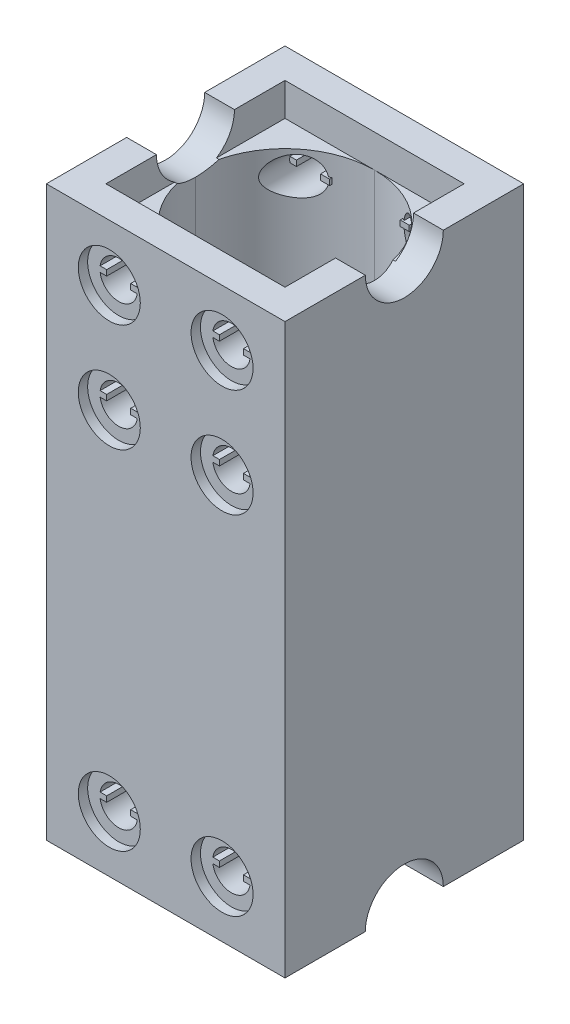
from build123d import *
from build123d.topology import SkipClean

# Parameters (mm, degrees)
SKETCH1_W           = 25.4
SKETCH1_H           = 25.4
SKETCH1_W_2         = 19.05
SKETCH1_H_2         = 19.05
BOSS_EXTRUDE1_DEPTH = 30.25
SKETCH2_R           = 2
CUT_EXTRUDE1_DEPTH  = 42.491113506
CUT_EXTRUDE2_DEPTH  = 42.491113506
CUT_EXTRUDE7_REACH  = 43.491
SKETCH9_R           = 2
FILLET1_START       = -9.525
FILLET1_OUTLINE_W   = 19.05
FILLET1_OUTLINE_H   = 60.5
FILLET1_OUTLINE_R   = 2
FILLET1_DEPTH       = 9.5000001
FILLET1_START_2     = 0.0249999
FILLET1_2_OUTLINE_W = 19.05
FILLET1_2_OUTLINE_H = 60.5
FILLET1_2_OUTLINE_R = 2
FILLET1_2_DEPTH     = 9.5000001
FILLET1_3_OUTLINE_R = 2
FILLET1_3_DEPTH     = 3.544211343
FILLET1_START_3     = -7.567803
FILLET1_4_OUTLINE_R = 2
FILLET1_4_DEPTH     = 2.380495584
FILLET1_5_DEPTH     = 19.05
FILLET1_START_4     = -0.025
FILLET1_6_DEPTH     = 0.0499999
FILLET1_START_5     = -30.25
FILLET1_7_DEPTH     = 60.5
FILLET1_START_6     = 10.7499999
FILLET1_8_DEPTH     = 4.0000001
SKETCH7_W           = 19.06
SKETCH7_H           = 19.06
CUT_EXTRUDE4_DEPTH  = 3.5
SKETCH4_R           = 1.175
CUT_EXTRUDE5_DEPTH  = 2.4
CUT_EXTRUDE8_DEPTH  = 2.4
BOSS_EXTRUDE3_DEPTH = 3.4
BOSS_EXTRUDE4_DEPTH = 3.4
SKETCH16_R          = 3.3
CUT_EXTRUDE9_DEPTH  = 1
SKETCH17_R          = 3.3
CUT_EXTRUDE10_DEPTH = 1


with BuildPart() as part:
    # Sketch1 → Boss-Extrude1 (new, symmetric)
    with BuildSketch(Plane(origin=(0, 0, 0), x_dir=(1, 0, 0), z_dir=(0, 1, 0))):
        Rectangle(SKETCH1_W, SKETCH1_H)
        Rectangle(SKETCH1_W_2, SKETCH1_H_2, mode=Mode.SUBTRACT)
    extrude(amount=BOSS_EXTRUDE1_DEPTH, both=True)

    # Sketch2 → Cut-Extrude1 (cut, through all)
    with BuildSketch(Plane(origin=(0, 0, 12.7), x_dir=(-1, 0, 0), z_dir=(0, 0, -1))):
        with Locations((-6, 24.25)):
            Circle(SKETCH2_R)
        with Locations((6, 24.25)):
            Circle(SKETCH2_R)
    cut_extrude1 = extrude(amount=CUT_EXTRUDE1_DEPTH, mode=Mode.SUBTRACT)

    # Sketch3 → Cut-Extrude2 (cut, through all)
    with BuildSketch(Plane(origin=(12.7, 0, 0), x_dir=(0, 0, -1), z_dir=(1, 0, 0))):
        with BuildLine():
            Line((-4.15, -30.25), (4.15, -30.25))
            ThreePointArc((4.15, -30.25), (0, -26.1), (-4.15, -30.25))
        make_face()
    cut_extrude2 = extrude(amount=-CUT_EXTRUDE2_DEPTH, mode=Mode.SUBTRACT)

    # Mirror2: Cut-Extrude1, Cut-Extrude2 across plane
    add(cut_extrude1.mirror(Plane.ZX), mode=Mode.SUBTRACT)
    add(cut_extrude2.mirror(Plane.ZX), mode=Mode.SUBTRACT)

    # Sketch9 → Cut-Extrude7 (cut, up to next)
    with BuildSketch(Plane.XY.offset(12.7), mode=Mode.PRIVATE) as cut_extrude7_sk1:
        with Locations((-6, 12.75)):
            Circle(SKETCH9_R)
    cut_extrude7_tool1 = extrude(cut_extrude7_sk1.sketch, amount=-CUT_EXTRUDE7_REACH, mode=Mode.PRIVATE) & part.part
    # Sketch9 → Cut-Extrude7 (cut, up to next)
    with BuildSketch(Plane.XY.offset(12.7), mode=Mode.PRIVATE) as cut_extrude7_sk2:
        with Locations((6, 12.75)):
            Circle(SKETCH9_R)
    cut_extrude7_tool2 = extrude(cut_extrude7_sk2.sketch, amount=-CUT_EXTRUDE7_REACH, mode=Mode.PRIVATE) & part.part
    add(cut_extrude7_tool1.solids().sort_by_distance((-6, 12.75, 12.7))[0], mode=Mode.SUBTRACT)
    add(cut_extrude7_tool2.solids().sort_by_distance((6, 12.75, 12.7))[0], mode=Mode.SUBTRACT)

    # Fillet1: read off the stored shape, not the designer's step
    # Fillet1 outline → Fillet1 (add)
    with SkipClean():  # the faces are left unmerged after this step: merging them gives an invalid solid
        with BuildSketch(Plane.XY.offset(FILLET1_START)):
            Rectangle(FILLET1_OUTLINE_W, FILLET1_OUTLINE_H)
            with Locations((-6, -24.25)):
                Circle(FILLET1_OUTLINE_R, mode=Mode.SUBTRACT)
            with Locations((6, -24.25)):
                Circle(FILLET1_OUTLINE_R, mode=Mode.SUBTRACT)
            with Locations((-6, 12.75)):
                Circle(FILLET1_OUTLINE_R, mode=Mode.SUBTRACT)
            with Locations((-6, 24.25)):
                Circle(FILLET1_OUTLINE_R, mode=Mode.SUBTRACT)
            with Locations((6, 12.75)):
                Circle(FILLET1_OUTLINE_R, mode=Mode.SUBTRACT)
            with Locations((6, 24.25)):
                Circle(FILLET1_OUTLINE_R, mode=Mode.SUBTRACT)
        extrude(amount=FILLET1_DEPTH)
    add(part.part.scale(1), mode=Mode.REPLACE)  # the faces are merged on a copy

    # Fillet1 2 outline → Fillet1 2 (add)
    with SkipClean():  # the faces are left unmerged after this step: merging them gives an invalid solid
        with BuildSketch(Plane.XY.offset(FILLET1_START_2)):
            Rectangle(FILLET1_2_OUTLINE_W, FILLET1_2_OUTLINE_H)
            with Locations((-6, -24.25)):
                Circle(FILLET1_2_OUTLINE_R, mode=Mode.SUBTRACT)
            with Locations((6, -24.25)):
                Circle(FILLET1_2_OUTLINE_R, mode=Mode.SUBTRACT)
            with Locations((-6, 12.75)):
                Circle(FILLET1_2_OUTLINE_R, mode=Mode.SUBTRACT)
            with Locations((-6, 24.25)):
                Circle(FILLET1_2_OUTLINE_R, mode=Mode.SUBTRACT)
            with Locations((6, 12.75)):
                Circle(FILLET1_2_OUTLINE_R, mode=Mode.SUBTRACT)
            with Locations((6, 24.25)):
                Circle(FILLET1_2_OUTLINE_R, mode=Mode.SUBTRACT)
        extrude(amount=FILLET1_2_DEPTH)

    # Fillet1 3 outline → Fillet1 3 (add)
    with BuildSketch(Plane.XY.offset(FILLET1_START)):
        with Locations((-6, 12.75)):
            Circle(FILLET1_3_OUTLINE_R)
        with Locations((6, 12.75)):
            Circle(FILLET1_3_OUTLINE_R)
    extrude(amount=FILLET1_3_DEPTH)

    # Fillet1 4 outline → Fillet1 4 (add)
    with BuildSketch(Plane.XY.offset(FILLET1_START_3)):
        with Locations((-6, 12.75)):
            Circle(FILLET1_4_OUTLINE_R)
    extrude(amount=FILLET1_4_DEPTH)

    # Fillet1 5 outline → Fillet1 5 (cut)
    with BuildSketch(Plane.YZ.offset(FILLET1_START)):
        with BuildLine():
            ThreePointArc((26.100075301, -0.0249999), (27.324359009, -2.94331867), (30.25, -4.15))
            Line((30.25, -4.15), (30.25, -0.0249999))
            Line((30.25, -0.0249999), (26.100075301, -0.0249999))
        make_face()
        with BuildLine():
            Line((-30.25, -0.0249999), (-30.25, -4.15))
            ThreePointArc((-30.25, -4.15), (-27.324359009, -2.94331867), (-26.100075301, -0.0249999))
            Line((-26.100075301, -0.0249999), (-30.25, -0.0249999))
        make_face()
        with BuildLine():
            ThreePointArc((30.25, 4.15), (27.324359009, 2.94331867), (26.100075301, 0.0249999))
            Line((26.100075301, 0.0249999), (30.25, 0.0249999))
            Line((30.25, 0.0249999), (30.25, 4.15))
        make_face()
        with BuildLine():
            Line((-30.25, 0.0249999), (-26.100075301, 0.0249999))
            ThreePointArc((-26.100075301, 0.0249999), (-27.324359009, 2.94331867), (-30.25, 4.15))
            Line((-30.25, 4.15), (-30.25, 0.0249999))
        make_face()
    extrude(amount=FILLET1_5_DEPTH, mode=Mode.SUBTRACT)

    # Fillet1 6 outline → Fillet1 6 (cut)
    with BuildSketch(Plane.YZ.offset(FILLET1_START_4)):
        with BuildLine():
            Line((-30.25, -9.525), (30.25, -9.525))
            Line((30.25, -9.525), (30.25, -4.15))
            ThreePointArc((30.25, -4.15), (27.324359009, -2.94331867), (26.100075301, -0.0249999))
            Line((26.100075301, -0.0249999), (-26.100075301, -0.0249999))
            ThreePointArc((-26.100075301, -0.0249999), (-27.324359009, -2.94331867), (-30.25, -4.15))
            Line((-30.25, -4.15), (-30.25, -9.525))
        make_face()
        with BuildLine():
            Line((-26.100075301, 0.0249999), (26.100075301, 0.0249999))
            ThreePointArc((26.100075301, 0.0249999), (27.324359009, 2.94331867), (30.25, 4.15))
            Line((30.25, 4.15), (30.25, 9.525))
            Line((30.25, 9.525), (-30.25, 9.525))
            Line((-30.25, 9.525), (-30.25, 4.15))
            ThreePointArc((-30.25, 4.15), (-27.324359009, 2.94331867), (-26.100075301, 0.0249999))
        make_face()
    extrude(amount=FILLET1_6_DEPTH, mode=Mode.SUBTRACT)

    # Fillet1 7 outline → Fillet1 7 (cut)
    with BuildSketch(Plane(origin=(0, 0, 0), x_dir=(1, 0, 0), z_dir=(0, 1, 0)).offset(FILLET1_START_5)):
        with BuildLine():
            Line((-0.025, 0.0249999), (-0.025, 9.525))
            ThreePointArc((-0.025, 9.525), (-6.742514439, 6.742514403), (-9.525, 0.02499995))
            Line((-9.525, 0.02499995), (-0.025, 0.0249999))
        make_face()
        with BuildLine():
            Line((0.02499995, 9.525), (0.0249999, 0.0249999))
            Line((0.0249999, 0.0249999), (9.525, 0.02499995))
            ThreePointArc((9.525, 0.02499995), (6.742514421, 6.742514421), (0.02499995, 9.525))
        make_face()
        with BuildLine():
            Line((-0.025, -0.0249999), (-9.525, -0.025))
            ThreePointArc((-9.525, -0.025), (-6.742514421, -6.742514421), (-0.025, -9.525))
            Line((-0.025, -9.525), (-0.025, -0.0249999))
        make_face()
        with BuildLine():
            Line((0.0249999, -0.0249999), (0.025, -9.525))
            ThreePointArc((0.025, -9.525), (6.742514421, -6.742514421), (9.525, -0.025))
            Line((9.525, -0.025), (0.0249999, -0.0249999))
        make_face()
    extrude(amount=FILLET1_7_DEPTH, mode=Mode.SUBTRACT)

    # Fillet1 8 outline → Fillet1 8 (add)
    with SkipClean():  # the faces are left unmerged after this step: merging them gives an invalid solid
        with BuildSketch(Plane(origin=(0, 0, 0), x_dir=(1, 0, 0), z_dir=(0, 1, 0)).offset(FILLET1_START_6)):
            with BuildLine():
                ThreePointArc((7.426255398, 5.980788657), (7.723356316, 5.591445007), (7.999997313, 5.187307416))
                Line((7.999997313, 5.187307416), (11, 5.187307416))
                Line((11, 5.187307416), (11, 5.980788657))
                Line((11, 5.980788657), (7.426255398, 5.980788657))
            make_face()
        extrude(amount=FILLET1_8_DEPTH)

    # Sketch7 → Cut-Extrude4 (cut)
    with SkipClean():  # the faces are left unmerged after this step: merging them gives an invalid solid
        with BuildSketch(Plane(origin=(0, 30.25, 0), x_dir=(1, 0, 0), z_dir=(0, 1, 0))):
            Rectangle(SKETCH7_W, SKETCH7_H)
        extrude(amount=-CUT_EXTRUDE4_DEPTH, mode=Mode.SUBTRACT)

    # Sketch4 → Cut-Extrude5 (cut)
    with SkipClean():  # the faces are left unmerged after this step: merging them gives an invalid solid
        with BuildSketch(Plane(origin=(0, -30.25, 0), x_dir=(1, 0, 0), z_dir=(0, 1, 0))):
            with Locations(Location((7.78, -7.78, 0), (0, 0, 270))):
                Circle(SKETCH4_R)
            with Locations(Location((-7.78, -7.78, 0), (0, 0, 270))):
                Circle(SKETCH4_R)
            with Locations(Location((7.78, 7.78, 0), (0, 0, 270))):
                Circle(SKETCH4_R)
            with Locations(Location((-7.78, 7.78, 0), (0, 0, 270))):
                Circle(SKETCH4_R)
        extrude(amount=CUT_EXTRUDE5_DEPTH, mode=Mode.SUBTRACT)

    # Sketch11 → Cut-Extrude8 (cut)
    with SkipClean():  # the faces are left unmerged after this step: merging them gives an invalid solid
        with BuildSketch(Plane.XZ.offset(30.25)):
            Polygon((-5.18, 6.2788893), (-5.18, 9.2811107), (-7.78, 10.7822214), (-10.38, 9.2811107), (-10.38, 6.2788893), (-7.78, 4.7777786), align=None)
            Polygon((10.38, 6.2788893), (7.78, 4.7777786), (5.18, 6.2788893), (5.18, 9.2811107), (7.78, 10.7822214), (10.38, 9.2811107), align=None)
            Polygon((5.18, -9.2811107), (7.78, -10.7822214), (10.38, -9.2811107), (10.38, -6.2788893), (7.78, -4.7777786), (5.18, -6.2788893), align=None)
            Polygon((-10.38, -6.2788893), (-7.78, -4.7777786), (-5.18, -6.2788893), (-5.18, -9.2811107), (-7.78, -10.7822214), (-10.38, -9.2811107), align=None)
        extrude(amount=-CUT_EXTRUDE8_DEPTH, mode=Mode.SUBTRACT)

    # Sketch13 → Boss-Extrude3 (add)
    with SkipClean():  # the faces are left unmerged after this step: merging them gives an invalid solid
        with BuildSketch(Plane.XY.offset(11.9)):
            Polygon((-7.977371993, 24.55), (-8.244428185, 24.55), (-8.244428185, 23.95), (-7.977371993, 23.95), (-7.277371993, 23.95), (-7.277371993, 24.55), align=None)
            Polygon((-4.022628007, 24.55), (-3.755571815, 24.55), (-3.755571815, 23.95), (-4.022628007, 23.95), (-4.722628007, 23.95), (-4.722628007, 24.55), align=None)
            Polygon((7.277371993, 24.55), (7.277371993, 23.95), (7.977371993, 23.95), (8.244428185, 23.95), (8.244428185, 24.55), (7.977371993, 24.55), align=None)
            Polygon((3.755571815, 24.55), (3.755571815, 23.95), (4.022628007, 23.95), (4.722628007, 23.95), (4.722628007, 24.55), (4.022628007, 24.55), align=None)
            Polygon((3.755571815, -23.95), (4.022628007, -23.95), (4.722628007, -23.95), (4.722628007, -24.55), (4.022628007, -24.55), (3.755571815, -24.55), align=None)
            Polygon((7.977371993, -23.95), (7.277371993, -23.95), (7.277371993, -24.55), (7.977371993, -24.55), (8.244428185, -24.55), (8.244428185, -23.95), align=None)
            Polygon((-4.022628007, -23.95), (-4.722628007, -23.95), (-4.722628007, -24.55), (-4.022628007, -24.55), (-3.755571815, -24.55), (-3.755571815, -23.95), align=None)
            Polygon((-8.244428185, -23.95), (-7.977371993, -23.95), (-7.277371993, -23.95), (-7.277371993, -24.55), (-7.977371993, -24.55), (-8.244428185, -24.55), align=None)
        boss_extrude3 = extrude(amount=-BOSS_EXTRUDE3_DEPTH)

    # Mirror3: Boss-Extrude3 across plane
    with SkipClean():  # the faces are left unmerged after this step: merging them gives an invalid solid
        add(boss_extrude3.mirror(Plane.XY))

    # Sketch14 → Boss-Extrude4 (add)
    with SkipClean():  # the faces are left unmerged after this step: merging them gives an invalid solid
        with BuildSketch(Plane.XY.offset(11.9)):
            Polygon((-7.977371993, 13.05), (-7.277371993, 13.05), (-7.277371993, 12.45), (-7.977371993, 12.45), (-8.215074094, 12.45), (-8.215074094, 13.05), align=None)
            Polygon((-4.722628007, 13.05), (-4.722628007, 12.45), (-4.022628007, 12.45), (-3.784925906, 12.45), (-3.784925906, 13.05), (-4.022628007, 13.05), align=None)
            Polygon((4.022628007, 12.45), (4.722628007, 12.45), (4.722628007, 13.05), (4.022628007, 13.05), (3.784925906, 13.05), (3.784925906, 12.45), align=None)
            Polygon((8.215074094, 12.45), (7.977371993, 12.45), (7.277371993, 12.45), (7.277371993, 13.05), (7.977371993, 13.05), (8.215074094, 13.05), align=None)
        extrude(amount=-BOSS_EXTRUDE4_DEPTH)

    # Sketch16 → Cut-Extrude9 (cut)
    with SkipClean():  # the faces are left unmerged after this step: merging them gives an invalid solid
        with BuildSketch(Plane.XY.offset(12.7)):
            with Locations((-6, 24.25)):
                Circle(SKETCH16_R)
            with Locations((6, 24.25)):
                Circle(SKETCH16_R)
            with Locations((-6, -24.25)):
                Circle(SKETCH16_R)
            with Locations((6, -24.25)):
                Circle(SKETCH16_R)
        cut_extrude9 = extrude(amount=-CUT_EXTRUDE9_DEPTH, mode=Mode.SUBTRACT)

    # Mirror4: Cut-Extrude9 across plane
    with SkipClean():  # the faces are left unmerged after this step: merging them gives an invalid solid
        add(cut_extrude9.mirror(Plane.XY), mode=Mode.SUBTRACT)

    # Sketch17 → Cut-Extrude10 (cut)
    with SkipClean():  # the faces are left unmerged after this step: merging them gives an invalid solid
        with BuildSketch(Plane.XY.offset(12.7)):
            with Locations((-6, 12.75)):
                Circle(SKETCH17_R)
            with Locations((6, 12.75)):
                Circle(SKETCH17_R)
        extrude(amount=-CUT_EXTRUDE10_DEPTH, mode=Mode.SUBTRACT)


solid = part.part
